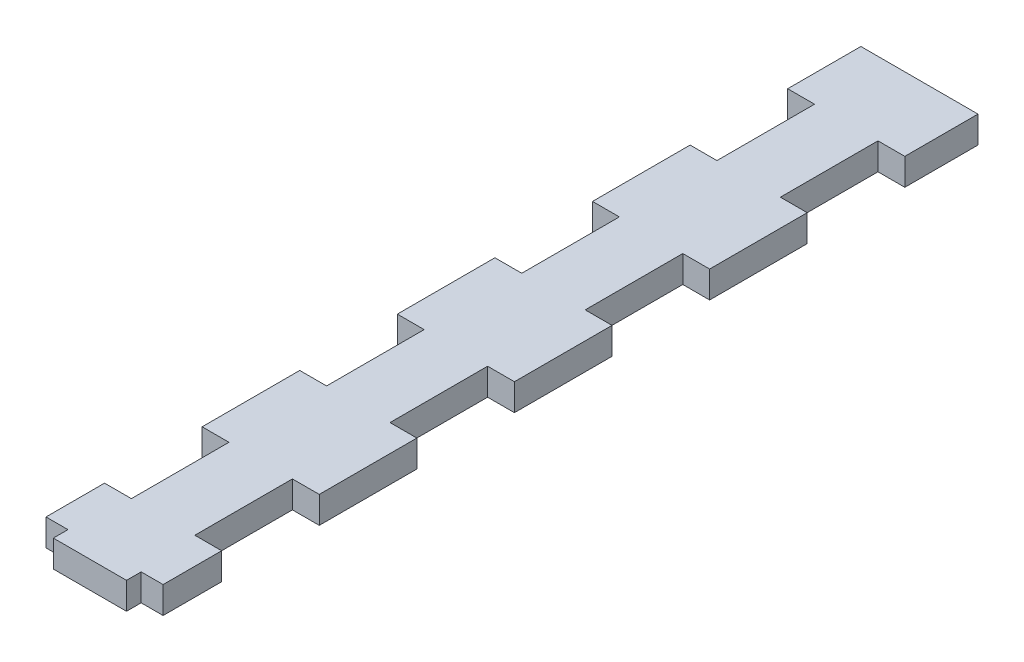
from build123d import *

# Parameters (mm, degrees)
SALIENTE_EXTRUIR1_DEPTH = 5.5


with BuildPart() as part:
    # Croquis1 → Saliente-Extruir1 (new body)
    with BuildSketch(Plane(origin=(0, 0, 0), x_dir=(1, 0, 0), z_dir=(0, 1, 0))):
        Polygon((4.5, 3), (4.5, 0), (12, 0), (19.5, 0), (19.5, 3), (24, 3), (24, 15), (18.5, 15), (18.5, 35), (24, 35), (24, 55), (18.5, 55), (18.5, 75), (24, 75), (24, 95), (18.5, 95), (18.5, 115), (24, 115), (24, 135), (18.5, 135), (18.5, 155), (24, 155), (24, 170), (0, 170), (0, 155), (5.5, 155), (5.5, 135), (0, 135), (0, 115), (5.5, 115), (5.5, 95), (0, 95), (0, 85), (0, 75), (5.5, 75), (5.5, 55), (0, 55), (0, 35), (5.5, 35), (5.5, 15), (0, 15), (0, 3), align=None)
    extrude(amount=SALIENTE_EXTRUIR1_DEPTH)


solid = part.part
